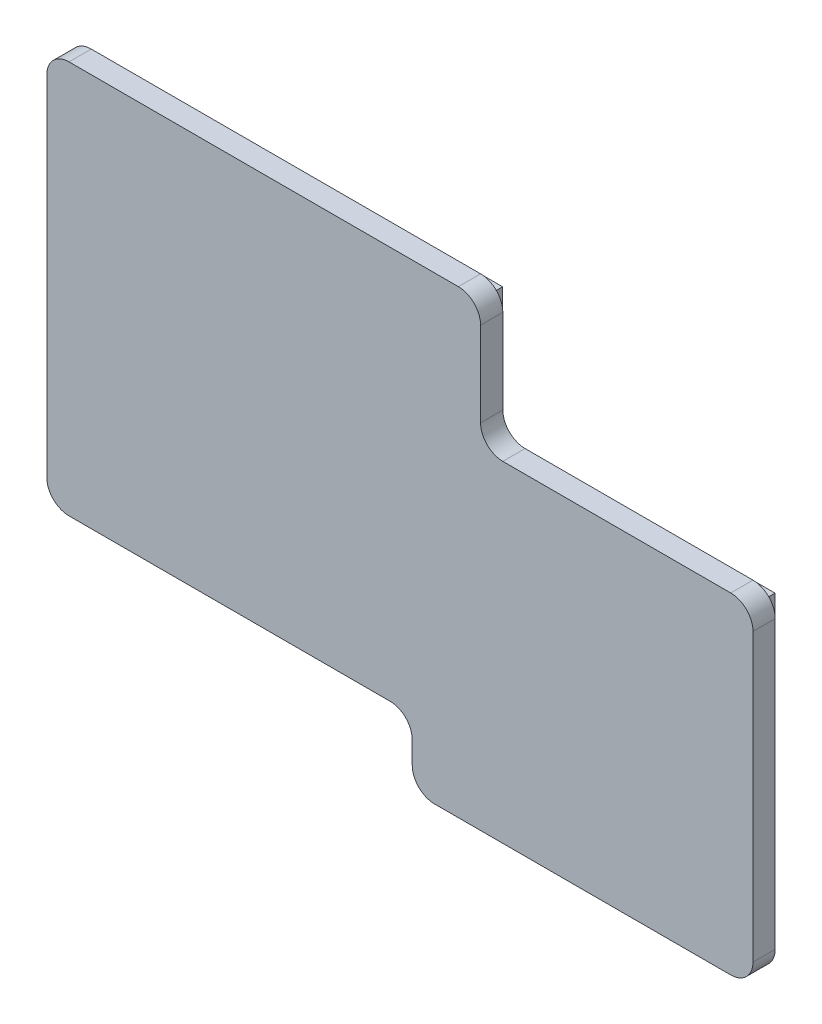
from build123d import *

# Parameters (mm, degrees)
BOSS_EXTRUDE1_DEPTH = 5
BOSS_EXTRUDE2_DEPTH = 5
SKETCH3_R           = 49.671400597
CUT_EXTRUDE1_DEPTH  = 3


# Read off the part's stored shape, not the designer's step: Boss-Extrude2
with BuildPart() as part:
    # Sketch1 → Boss-Extrude1 (new body)
    with BuildSketch(Plane.XY):
        with BuildLine():
            Line((-140.302659687, 8.355782272), (-68.12, 8.355782272))
            ThreePointArc((-68.12, 8.355782272), (-64.584466094, 6.891316178), (-63.12, 3.355782272))
            Line((-63.12, 3.355782272), (-63.12, -1.644217728))
            ThreePointArc((-63.12, -1.644217728), (-61.655533906, -5.179751634), (-58.12, -6.644217728))
            Line((-58.12, -6.644217728), (8.507075949, -6.644217728))
            ThreePointArc((8.507075949, -6.644217728), (12.042609855, -5.179751634), (13.507075949, -1.644217728))
            Line((13.507075949, -1.644217728), (13.507075949, 62.750348787))
            ThreePointArc((13.507075949, 62.750348787), (12.042609855, 66.285882693), (8.507075949, 67.750348787))
            Line((8.507075949, 67.750348787), (-42.74804895, 67.750348787))
            ThreePointArc((-42.74804895, 67.750348787), (-46.283582856, 69.214814881), (-47.74804895, 72.750348787))
            Line((-47.74804895, 72.750348787), (-47.74804895, 91.776437317))
            ThreePointArc((-47.74804895, 91.776437317), (-49.212515044, 95.311971223), (-52.74804895, 96.776437317))
            Line((-52.74804895, 96.776437317), (-140.302659687, 96.776437317))
            ThreePointArc((-140.302659687, 96.776437317), (-143.838193593, 95.311971223), (-145.302659687, 91.776437317))
            Line((-145.302659687, 91.776437317), (-145.302659687, 13.355782272))
            ThreePointArc((-145.302659687, 13.355782272), (-143.838193593, 9.820248366), (-140.302659687, 8.355782272))
        make_face()
    extrude(amount=BOSS_EXTRUDE1_DEPTH)

    # Boss-Extrude2 outline → Boss-Extrude2 (add)
    with BuildSketch(Plane(origin=(0, 0, 0), x_dir=(-1, 0, 0), z_dir=(0, 0, -1))):
        Polygon((52.79804895, 91.726437317), (52.79804895, 62.700348787), (-8.457075949, 62.700348787), (-8.457075949, -1.594217728), (58.07, -1.594217728), (58.07, 13.405782272), (140.252659687, 13.405782272), (140.252659687, 91.726437317), align=None)
        Polygon((137.252659687, 16.405782272), (55.79804895, 16.405782272), (55.07, 17.506577949), (55.07, 1.405782272), (-5.457075949, 1.405782272), (-5.457075949, 59.700348787), (55.79804895, 59.700348787), (55.79804895, 88.726437317), (137.252659687, 88.726437317), align=None, mode=Mode.SUBTRACT)
    extrude(amount=BOSS_EXTRUDE2_DEPTH)

    # Sketch3 → Cut-Extrude1 (cut)
    with BuildSketch(Plane.XZ.offset(-88.726437317)):
        with Locations((-95.146165884, -48.5)):
            Circle(SKETCH3_R)
    extrude(amount=-CUT_EXTRUDE1_DEPTH, mode=Mode.SUBTRACT)


solid = part.part
